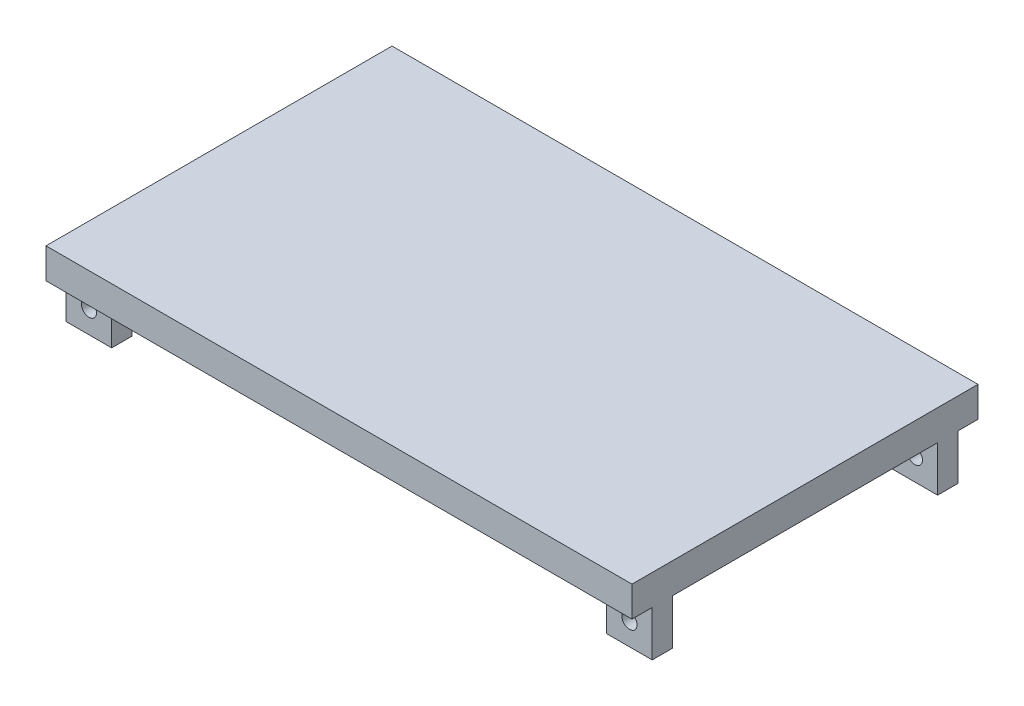
from build123d import *

# Parameters (mm, degrees)
SKETCH1_W           = 116
SKETCH1_H           = 34.25
BOSS_EXTRUDE2_DEPTH = 6
SKETCH3_W           = 9
SKETCH3_H           = 4
BOSS_EXTRUDE3_DEPTH = 9
SKETCH4_R           = 1.5
CUT_EXTRUDE1_DEPTH  = 121.216731365


with BuildPart() as part:
    # Sketch1 → Boss-Extrude2 (new body)
    with BuildSketch(Plane(origin=(0, 0, 0), x_dir=(1, 0, 0), z_dir=(0, 1, 0))):
        with Locations((-58, 17.125)):
            Rectangle(SKETCH1_W, SKETCH1_H)
    boss_extrude2 = extrude(amount=BOSS_EXTRUDE2_DEPTH)

    # Sketch3 → Boss-Extrude3 (add)
    with BuildSketch(Plane.XZ):
        with Locations((-111.5, -6)):
            Rectangle(SKETCH3_W, SKETCH3_H)
        with Locations((-4.5, -6)):
            Rectangle(SKETCH3_W, SKETCH3_H)
    boss_extrude3 = extrude(amount=BOSS_EXTRUDE3_DEPTH)

    # Sketch4 → Cut-Extrude1 (cut, through all)
    with BuildSketch(Plane.XY.offset(-4)):
        with Locations((-111.5, -4.5)):
            Circle(SKETCH4_R)
        with Locations((-4.5, -4.5)):
            Circle(SKETCH4_R)
    cut_extrude1 = extrude(amount=-CUT_EXTRUDE1_DEPTH, mode=Mode.SUBTRACT)

    # Mirror1: Boss-Extrude2, Boss-Extrude3, Cut-Extrude1 across plane
    add(boss_extrude2.mirror(Plane(origin=(0, 6, -34.25), x_dir=(1, 0, 0), z_dir=(0, 0, 1))))
    add(boss_extrude3.mirror(Plane(origin=(0, 6, -34.25), x_dir=(1, 0, 0), z_dir=(0, 0, 1))))
    add(cut_extrude1.mirror(Plane(origin=(0, 6, -34.25), x_dir=(1, 0, 0), z_dir=(0, 0, 1))), mode=Mode.SUBTRACT)


solid = part.part
